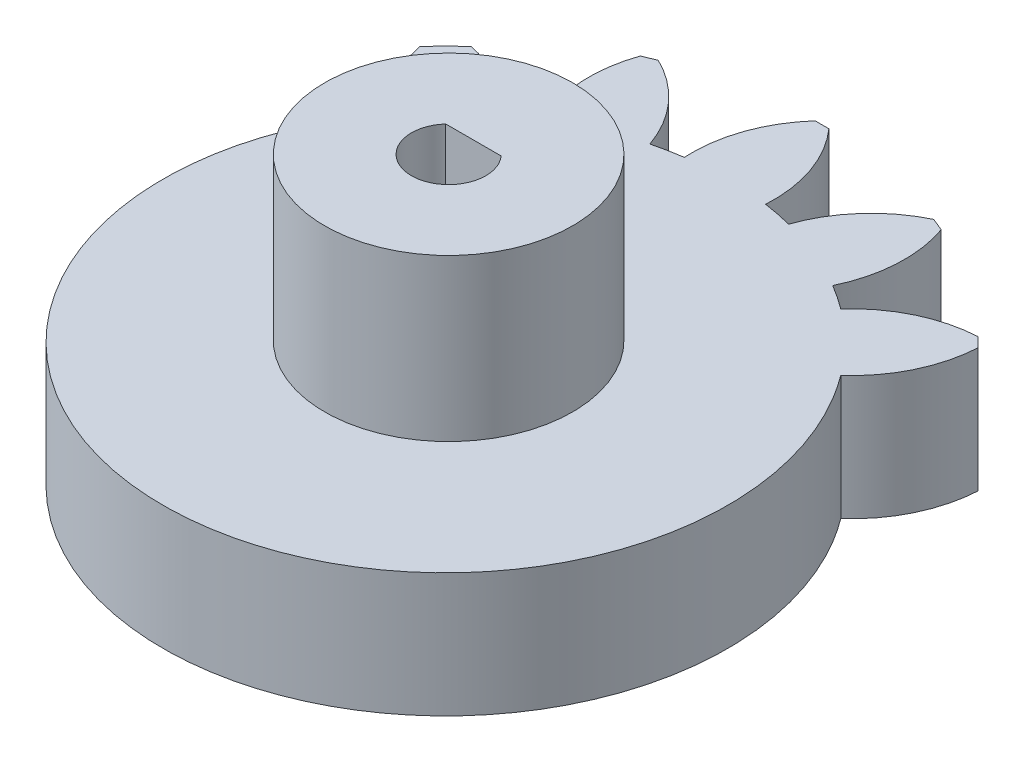
from build123d import *
from build123d.topology import SkipClean

# Parameters (mm, degrees)
CIRPATTERN3_COUNT   = 16
CUT_EXTRUDE1_DEPTH  = 20.735754356
CUT_EXTRUDE2_DEPTH  = 18.6001598
SCALE1_SCALE_X      = 1.125
SCALE1_SCALE_Y      = 1
SCALE1_SCALE_Z      = 1.125
SKETCH6_R           = 0.75
CUT_EXTRUDE4_DEPTH  = 0.5
CUT_EXTRUDE3_DEPTH  = 20.534566129
BOSS_EXTRUDE1_START = 6.5
SKETCH7_R           = 5
BOSS_EXTRUDE1_DEPTH = 6.5


with BuildPart() as part:
    # Sweep1: sweep along a path in Sketch2
    with BuildLine(Plane(origin=(0, 0, 0), x_dir=(0, 0, -1), z_dir=(1, 0, 0))) as sweep1_path:
        Line((0, 0), (0, 5))
    # Sketch1 → Sweep1 (sweep)
    with BuildSketch(Plane(origin=(0, 0, 0), x_dir=(1, 0, 0), z_dir=(0, 1, 0))):
        with BuildLine():
            Line((-1.97528951, 9.930450964), (0, 0))
            Line((0, 0), (1.97528951, 9.930450964))
            ThreePointArc((1.97528951, 9.930450964), (1.716948331, 9.978362262), (1.457450931, 10.019553971))
            ThreePointArc((1.457450931, 10.019553971), (1.198543798, 11.879493053), (0.245855608, 13.497761111))
            ThreePointArc((0.245855608, 13.497761111), (0, 13.5), (-0.245855608, 13.497761111))
            ThreePointArc((-0.245855608, 13.497761111), (-1.198543798, 11.879493053), (-1.457450931, 10.019553971))
            ThreePointArc((-1.457450931, 10.019553971), (-1.716948331, 9.978362262), (-1.97528951, 9.930450964))
        make_face()
    sweep1 = sweep(path=sweep1_path.line)

    # CirPattern3: Sweep1 ×16 about axis
    cirpattern3_axis = Axis((0, 5.25, 0), (0, -1, 0))
    for i in range(1, CIRPATTERN3_COUNT):
        add(sweep1.rotate(cirpattern3_axis, i * 360 / CIRPATTERN3_COUNT))

    # Sketch3 → Cut-Extrude1 (cut, through all)
    with BuildSketch(Plane(origin=(0, 5, 0), x_dir=(1, 0, 0), z_dir=(0, 1, 0))):
        with BuildLine():
            Line((11.586219375, 6.928890286), (8.689664531, 5.196667714))
            ThreePointArc((8.689664531, 5.196667714), (0.009223955, -10.124995798), (-8.699118514, 5.180826389))
            Line((-8.699118514, 5.180826389), (-11.744679969, 6.656762909))
            ThreePointArc((-11.744679969, 6.656762909), (0.15745084, -13.499081792), (11.586219375, 6.928890286))
        make_face()
    extrude(amount=-CUT_EXTRUDE1_DEPTH, mode=Mode.SUBTRACT)

    # Sketch4 → Cut-Extrude2 (cut, through all)
    with BuildSketch(Plane(origin=(0, 5, 0), x_dir=(1, 0, 0), z_dir=(0, 1, 0))):
        with BuildLine():
            Line((-9.637501349, 8.724595564), (-9.755595035, 9.33157894))
            ThreePointArc((-9.755595035, 9.33157894), (-9.545941546, 9.545941546), (-9.33157894, 9.755595035))
            Line((-9.33157894, 9.755595035), (-8.724595564, 9.637501349))
            ThreePointArc((-8.724595564, 9.637501349), (-9.192388155, 9.192388155), (-9.637501349, 8.724595564))
        make_face()
    extrude(amount=-CUT_EXTRUDE2_DEPTH, mode=Mode.SUBTRACT)


with BuildPart() as part_1:
    # Scale1: scaled about (0.011816285, 2.5, -1.015835728)
    add(part.part.scale((SCALE1_SCALE_X, SCALE1_SCALE_Y, SCALE1_SCALE_Z), about=(0.011816285, 2.5, -1.015835728)))

    # Sketch6 → Cut-Extrude4 (cut)
    with BuildSketch(Plane(origin=(0, 5, 0), x_dir=(1, 0, 0), z_dir=(0, 1, 0))):
        with Locations((-5.692091015, 5.621396613)):
            Circle(SKETCH6_R)
    cut_extrude4 = extrude(amount=-CUT_EXTRUDE4_DEPTH, mode=Mode.SUBTRACT)

    # Mirror1: Cut-Extrude4 across plane
    add(cut_extrude4.mirror(Plane(origin=(0, 2.5, 0), x_dir=(0, 0, 1), z_dir=(0, -1, 0))), mode=Mode.SUBTRACT)

    # Sketch5 → Cut-Extrude3 (cut, through all)
    with BuildSketch(Plane(origin=(0, 5, 0), x_dir=(1, 0, 0), z_dir=(0, 1, 0))):
        with BuildLine():
            Line((-1.118033989, 1), (1.118033989, 1))
            ThreePointArc((1.118033989, 1), (0, -1.5), (-1.118033989, 1))
        make_face()
    extrude(amount=-CUT_EXTRUDE3_DEPTH, mode=Mode.SUBTRACT)

    # Sketch7 → Boss-Extrude1 (add)
    with SkipClean():  # the faces are left unmerged after this step: merging them gives an invalid solid
        with BuildSketch(Plane(origin=(0, 5, 0), x_dir=(1, 0, 0), z_dir=(0, 1, 0)).offset(BOSS_EXTRUDE1_START)):
            Circle(SKETCH7_R)
            with BuildLine():
                Line((1.118033989, 1), (-1.118033989, 1))
                ThreePointArc((-1.118033989, 1), (0, -1.5), (1.118033989, 1))
            make_face(mode=Mode.SUBTRACT)
        extrude(amount=-BOSS_EXTRUDE1_DEPTH)


solid = part_1.part
